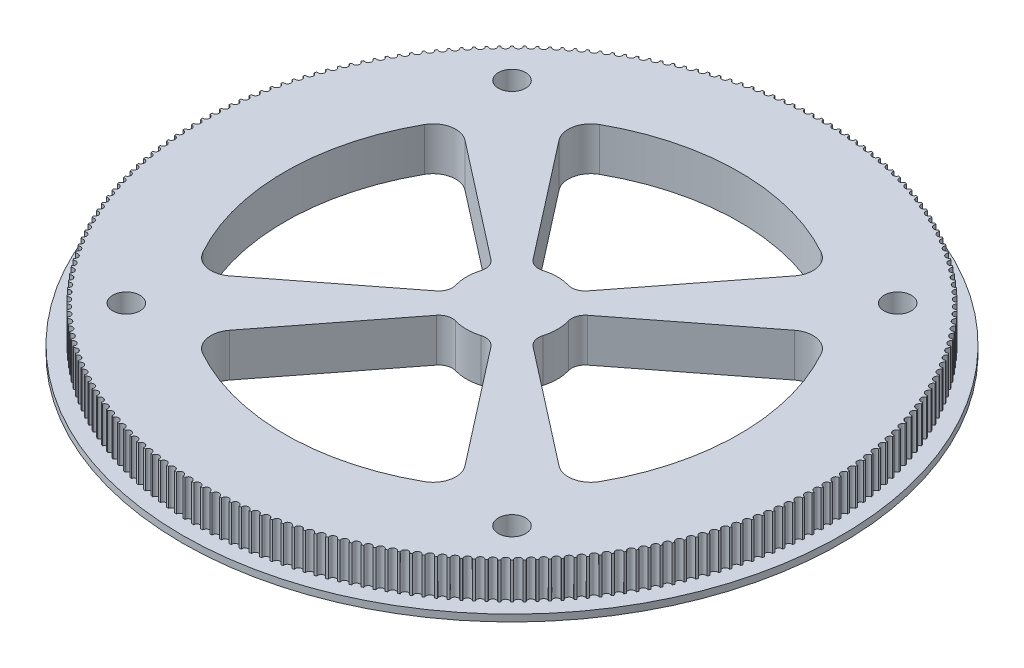
from build123d import *

# Parameters (mm, degrees)
BOSS_EXTRUDE1_DEPTH = 8
SKETCH3_R           = 72.5
BOSS_EXTRUDE3_DEPTH = 1.5
SKETCH6_R           = 3
CUT_EXTRUDE3_DEPTH  = 103.969655724
CUT_EXTRUDE4_DEPTH  = 103.969655724
FILLET1_R           = 3
FILLET2_R           = 5


with BuildPart() as part:
    # Sketch1 → Boss-Extrude1 (new body)
    with BuildSketch(Plane(origin=(0, 0, 0), x_dir=(1, 0, 0), z_dir=(0, 1, 0))):
        with BuildLine():
            ThreePointArc((-0.759988559, 69.250829904), (-0.988925477, 69.247938969), (-1.217851586, 69.244291191))
            ThreePointArc((-1.217851586, 69.244291191), (-1.955946699, 68.467067248), (-2.737208847, 69.200886647))
            ThreePointArc((-2.737208847, 69.200886647), (-2.965969848, 69.191459356), (-3.194698434, 69.18127584))
            ThreePointArc((-3.194698434, 69.18127584), (-3.9102981, 68.383291773), (-4.712196627, 69.094502154))
            ThreePointArc((-4.712196627, 69.094502154), (-4.940595132, 69.078546197), (-5.168939639, 69.061835249))
            ThreePointArc((-5.168939639, 69.061835249), (-5.861460206, 68.243741905), (-6.683341073, 68.931763195))
            ThreePointArc((-6.683341073, 68.931763195), (-6.911190796, 68.909291585), (-7.138964984, 68.886066835))
            ThreePointArc((-7.138964984, 68.886066835), (-7.80784162, 68.048531463), (-8.64903449, 68.7128025))
            ThreePointArc((-8.64903449, 68.7128025), (-8.876149594, 68.683833566), (-9.103167686, 68.654113956))
            ThreePointArc((-9.103167686, 68.654113956), (-9.747854848, 67.797819662), (-10.60767363, 68.437798658))
            ThreePointArc((-10.60767363, 68.437798658), (-10.833868876, 68.402356028), (-11.059945715, 68.366165797))
            ThreePointArc((-11.059945715, 68.366165797), (-11.679917584, 67.491810986), (-12.557660999, 68.106975966))
            ThreePointArc((-12.557660999, 68.106975966), (-12.7827519, 68.065088547), (-13.007703093, 68.022457213))
            ThreePointArc((-13.007703093, 68.022457213), (-13.602454013, 67.130755022), (-14.49740616, 67.720604247))
            ThreePointArc((-14.49740616, 67.720604247), (-14.721209128, 67.672306203), (-14.944851201, 67.623268537))
            ThreePointArc((-14.944851201, 67.623268537), (-15.513896085, 66.714946251), (-16.425327028, 67.278998633))
            ThreePointArc((-16.425327028, 67.278998633), (-16.647659527, 67.224329355), (-16.869810075, 67.168925353))
            ThreePointArc((-16.869810075, 67.168925353), (-17.412684801, 66.244723813), (-18.339851164, 66.782519302))
            ThreePointArc((-18.339851164, 66.782519302), (-18.560531855, 66.721523381), (-18.78100969, 66.65979823))
            ThreePointArc((-18.78100969, 66.65979823), (-19.297271481, 65.720471228), (-20.239417055, 66.23157119))
            ThreePointArc((-20.239417055, 66.23157119), (-20.458265948, 66.164298375), (-20.676891243, 66.096302419))
            ThreePointArc((-20.676891243, 66.096302419), (-21.16611903, 65.142616084), (-22.122475387, 65.626603659))
            ThreePointArc((-22.122475387, 65.626603659), (-22.339313986, 65.553108818), (-22.555908428, 65.478897517))
            ThreePointArc((-22.555908428, 65.478897517), (-23.017703188, 64.511629687), (-23.98749031, 64.968110128))
            ThreePointArc((-23.98749031, 64.968110128), (-24.202141758, 64.888453205), (-24.41652869, 64.808087086))
            ThreePointArc((-24.41652869, 64.808087086), (-24.850513778, 63.828026681), (-25.832940692, 64.256627675))
            ThreePointArc((-25.832940692, 64.256627675), (-26.045229917, 64.170873639), (-26.257234481, 64.08441825))
            ThreePointArc((-26.257234481, 64.08441825), (-26.663055932, 63.09236462), (-27.657321357, 63.492736595))
            ThreePointArc((-27.657321357, 63.492736595), (-27.867075212, 63.400955388), (-28.076524495, 63.308481243))
            ThreePointArc((-28.076524495, 63.308481243), (-28.453851316, 62.305243522), (-29.459144315, 62.677059928))
            ThreePointArc((-29.459144315, 62.677059928), (-29.666191722, 62.579326408), (-29.872914893, 62.48090893))
            ThreePointArc((-29.872914893, 62.48090893), (-30.22143933, 61.467305373), (-31.236939971, 61.810262952))
            ThreePointArc((-31.236939971, 61.810262952), (-31.441112059, 61.706656833), (-31.644940513, 61.602376293))
            ThreePointArc((-31.644940513, 61.602376293), (-31.964378304, 60.579233609), (-32.989258331, 60.893052639))
            ThreePointArc((-32.989258331, 60.893052639), (-33.190388575, 60.783658422), (-33.391156066, 60.673599873))
            ThreePointArc((-33.391156066, 60.673599873), (-33.681246674, 59.641752552), (-34.71467018, 59.926177079))
            ThreePointArc((-34.71467018, 59.926177079), (-34.912594534, 59.811083989), (-35.110137313, 59.695337195))
            ThreePointArc((-35.110137313, 59.695337195), (-35.370644135, 58.655626827), (-36.411768245, 58.910424869))
            ThreePointArc((-36.411768245, 58.910424869), (-36.60632528, 58.789726777), (-36.800482228, 58.668386144))
            ThreePointArc((-36.800482228, 58.668386144), (-37.031192792, 57.621660731), (-38.079168349, 57.846624472))
            ThreePointArc((-38.079168349, 57.846624472), (-38.270199382, 57.72041982), (-38.460812142, 57.593584316))
            ThreePointArc((-38.460812142, 57.593584316), (-38.661538276, 56.540697582), (-39.715510538, 56.735643538))
            ThreePointArc((-39.715510538, 56.735643538), (-39.902859761, 56.604035262), (-40.089772867, 56.471808334))
            ThreePointArc((-40.089772867, 56.471808334), (-40.260350856, 55.41361903), (-41.319460187, 55.5783882))
            ThreePointArc((-41.319460187, 55.5783882), (-41.502974794, 55.44148364), (-41.686035797, 55.303973135))
            ThreePointArc((-41.686035797, 55.303973135), (-41.826326516, 54.241344334), (-42.889709091, 54.375802331))
            ThreePointArc((-42.889709091, 54.375802331), (-43.069239406, 54.233713149), (-43.248298998, 54.091031223))
            ThreePointArc((-43.248298998, 54.091031223), (-43.358188024, 53.024829621), (-44.424976533, 53.128866777))
            ThreePointArc((-44.424976533, 53.128866777), (-44.600376129, 52.981708864), (-44.775288267, 52.833971889))
            ThreePointArc((-44.775288267, 52.833971889), (-44.854685972, 51.765067095), (-45.924010327, 51.838598558))
            ThreePointArc((-45.924010327, 51.838598558), (-46.095136145, 51.686491937), (-46.265758168, 51.533820411))
            ThreePointArc((-46.265758168, 51.533820411), (-46.314599794, 50.463084239), (-47.38558784, 50.506050034))
            ThreePointArc((-47.38558784, 50.506050034), (-47.552300307, 50.349118766), (-47.718493053, 50.191637209))
            ThreePointArc((-47.718493053, 50.191637209), (-47.736738765, 49.119942967), (-48.808516988, 49.132308051))
            ThreePointArc((-48.808516988, 49.132308051), (-48.970680131, 48.970680131), (-49.132308051, 48.808516988))
            ThreePointArc((-49.132308051, 48.808516988), (-49.119942967, 47.736738765), (-50.191637209, 47.718493053))
            ThreePointArc((-50.191637209, 47.718493053), (-50.349118766, 47.552300307), (-50.506050034, 47.38558784))
            ThreePointArc((-50.506050034, 47.38558784), (-50.463084239, 46.314599794), (-51.533820411, 46.265758168))
            ThreePointArc((-51.533820411, 46.265758168), (-51.686491937, 46.095136145), (-51.838598558, 45.924010327))
            ThreePointArc((-51.838598558, 45.924010327), (-51.765067095, 44.854685972), (-52.833971889, 44.775288267))
            ThreePointArc((-52.833971889, 44.775288267), (-52.981708864, 44.600376129), (-53.128866777, 44.424976533))
            ThreePointArc((-53.128866777, 44.424976533), (-53.024829621, 43.358188024), (-54.091031223, 43.248298998))
            ThreePointArc((-54.091031223, 43.248298998), (-54.233713149, 43.069239406), (-54.375802331, 42.889709091))
            ThreePointArc((-54.375802331, 42.889709091), (-54.241344334, 41.826326516), (-55.303973135, 41.686035797))
            ThreePointArc((-55.303973135, 41.686035797), (-55.44148364, 41.502974794), (-55.5783882, 41.319460187))
            ThreePointArc((-55.5783882, 41.319460187), (-55.41361903, 40.260350856), (-56.471808334, 40.089772867))
            ThreePointArc((-56.471808334, 40.089772867), (-56.604035262, 39.902859761), (-56.735643538, 39.715510538))
            ThreePointArc((-56.735643538, 39.715510538), (-56.540697582, 38.661538276), (-57.593584316, 38.460812142))
            ThreePointArc((-57.593584316, 38.460812142), (-57.72041982, 38.270199382), (-57.846624472, 38.079168349))
            ThreePointArc((-57.846624472, 38.079168349), (-57.621660731, 37.031192792), (-58.668386144, 36.800482228))
            ThreePointArc((-58.668386144, 36.800482228), (-58.789726777, 36.60632528), (-58.910424869, 36.411768245))
            ThreePointArc((-58.910424869, 36.411768245), (-58.655626827, 35.370644135), (-59.695337195, 35.110137313))
            ThreePointArc((-59.695337195, 35.110137313), (-59.811083989, 34.912594534), (-59.926177079, 34.71467018))
            ThreePointArc((-59.926177079, 34.71467018), (-59.641752552, 33.681246674), (-60.673599873, 33.391156066))
            ThreePointArc((-60.673599873, 33.391156066), (-60.783658422, 33.190388575), (-60.893052639, 32.989258331))
            ThreePointArc((-60.893052639, 32.989258331), (-60.579233609, 31.964378304), (-61.602376293, 31.644940513))
            ThreePointArc((-61.602376293, 31.644940513), (-61.706656833, 31.441112059), (-61.810262952, 31.236939971))
            ThreePointArc((-61.810262952, 31.236939971), (-61.467305373, 30.22143933), (-62.48090893, 29.872914893))
            ThreePointArc((-62.48090893, 29.872914893), (-62.579326408, 29.666191722), (-62.677059928, 29.459144315))
            ThreePointArc((-62.677059928, 29.459144315), (-62.305243522, 28.453851316), (-63.308481243, 28.076524495))
            ThreePointArc((-63.308481243, 28.076524495), (-63.400955388, 27.867075212), (-63.492736595, 27.657321357))
            ThreePointArc((-63.492736595, 27.657321357), (-63.09236462, 26.663055932), (-64.08441825, 26.257234481))
            ThreePointArc((-64.08441825, 26.257234481), (-64.170873639, 26.045229917), (-64.256627675, 25.832940692))
            ThreePointArc((-64.256627675, 25.832940692), (-63.828026681, 24.850513778), (-64.808087086, 24.41652869))
            ThreePointArc((-64.808087086, 24.41652869), (-64.888453205, 24.202141758), (-64.968110128, 23.98749031))
            ThreePointArc((-64.968110128, 23.98749031), (-64.511629687, 23.017703188), (-65.478897517, 22.555908428))
            ThreePointArc((-65.478897517, 22.555908428), (-65.553108818, 22.339313986), (-65.626603659, 22.122475387))
            ThreePointArc((-65.626603659, 22.122475387), (-65.142616084, 21.16611903), (-66.096302419, 20.676891243))
            ThreePointArc((-66.096302419, 20.676891243), (-66.164298375, 20.458265948), (-66.23157119, 20.239417055))
            ThreePointArc((-66.23157119, 20.239417055), (-65.720471228, 19.297271481), (-66.65979823, 18.78100969))
            ThreePointArc((-66.65979823, 18.78100969), (-66.721523381, 18.560531855), (-66.782519302, 18.339851164))
            ThreePointArc((-66.782519302, 18.339851164), (-66.244723813, 17.412684801), (-67.168925353, 16.869810075))
            ThreePointArc((-67.168925353, 16.869810075), (-67.224329355, 16.647659527), (-67.278998633, 16.425327028))
            ThreePointArc((-67.278998633, 16.425327028), (-66.714946251, 15.513896085), (-67.623268537, 14.944851201))
            ThreePointArc((-67.623268537, 14.944851201), (-67.672306203, 14.721209128), (-67.720604247, 14.49740616))
            ThreePointArc((-67.720604247, 14.49740616), (-67.130755022, 13.602454013), (-68.022457213, 13.007703093))
            ThreePointArc((-68.022457213, 13.007703093), (-68.065088547, 12.7827519), (-68.106975966, 12.557660999))
            ThreePointArc((-68.106975966, 12.557660999), (-67.491810986, 11.679917584), (-68.366165797, 11.059945715))
            ThreePointArc((-68.366165797, 11.059945715), (-68.402356028, 10.833868876), (-68.437798658, 10.60767363))
            ThreePointArc((-68.437798658, 10.60767363), (-67.797819662, 9.747854848), (-68.654113956, 9.103167686))
            ThreePointArc((-68.654113956, 9.103167686), (-68.683833566, 8.876149594), (-68.7128025, 8.64903449))
            ThreePointArc((-68.7128025, 8.64903449), (-68.048531463, 7.80784162), (-68.886066835, 7.138964984))
            ThreePointArc((-68.886066835, 7.138964984), (-68.909291585, 6.911190796), (-68.931763195, 6.683341073))
            ThreePointArc((-68.931763195, 6.683341073), (-68.243741905, 5.861460206), (-69.061835249, 5.168939639))
            ThreePointArc((-69.061835249, 5.168939639), (-69.078546197, 4.940595132), (-69.094502154, 4.712196627))
            ThreePointArc((-69.094502154, 4.712196627), (-68.383291773, 3.9102981), (-69.18127584, 3.194698434))
            ThreePointArc((-69.18127584, 3.194698434), (-69.191459356, 2.965969848), (-69.200886647, 2.737208847))
            ThreePointArc((-69.200886647, 2.737208847), (-68.467067248, 1.955946699), (-69.244291191, 1.217851586))
            ThreePointArc((-69.244291191, 1.217851586), (-69.247938969, 0.988925477), (-69.250829904, 0.759988559))
            ThreePointArc((-69.250829904, 0.759988559), (-68.495, 0), (-69.250829904, -0.759988559))
            ThreePointArc((-69.250829904, -0.759988559), (-69.247938969, -0.988925477), (-69.244291191, -1.217851586))
            ThreePointArc((-69.244291191, -1.217851586), (-68.467067248, -1.955946699), (-69.200886647, -2.737208847))
            ThreePointArc((-69.200886647, -2.737208847), (-69.191459356, -2.965969848), (-69.18127584, -3.194698434))
            ThreePointArc((-69.18127584, -3.194698434), (-68.383291773, -3.9102981), (-69.094502154, -4.712196627))
            ThreePointArc((-69.094502154, -4.712196627), (-69.078546197, -4.940595132), (-69.061835249, -5.168939639))
            ThreePointArc((-69.061835249, -5.168939639), (-68.243741905, -5.861460206), (-68.931763195, -6.683341073))
            ThreePointArc((-68.931763195, -6.683341073), (-68.909291585, -6.911190796), (-68.886066835, -7.138964984))
            ThreePointArc((-68.886066835, -7.138964984), (-68.048531463, -7.80784162), (-68.7128025, -8.64903449))
            ThreePointArc((-68.7128025, -8.64903449), (-68.683833566, -8.876149594), (-68.654113956, -9.103167686))
            ThreePointArc((-68.654113956, -9.103167686), (-67.797819662, -9.747854848), (-68.437798658, -10.60767363))
            ThreePointArc((-68.437798658, -10.60767363), (-68.402356028, -10.833868876), (-68.366165797, -11.059945715))
            ThreePointArc((-68.366165797, -11.059945715), (-67.491810986, -11.679917584), (-68.106975966, -12.557660999))
            ThreePointArc((-68.106975966, -12.557660999), (-68.065088547, -12.7827519), (-68.022457213, -13.007703093))
            ThreePointArc((-68.022457213, -13.007703093), (-67.130755022, -13.602454013), (-67.720604247, -14.49740616))
            ThreePointArc((-67.720604247, -14.49740616), (-67.672306203, -14.721209128), (-67.623268537, -14.944851201))
            ThreePointArc((-67.623268537, -14.944851201), (-66.714946251, -15.513896085), (-67.278998633, -16.425327028))
            ThreePointArc((-67.278998633, -16.425327028), (-67.224329355, -16.647659527), (-67.168925353, -16.869810075))
            ThreePointArc((-67.168925353, -16.869810075), (-66.244723813, -17.412684801), (-66.782519302, -18.339851164))
            ThreePointArc((-66.782519302, -18.339851164), (-66.721523381, -18.560531855), (-66.65979823, -18.78100969))
            ThreePointArc((-66.65979823, -18.78100969), (-65.720471228, -19.297271481), (-66.23157119, -20.239417055))
            ThreePointArc((-66.23157119, -20.239417055), (-66.164298375, -20.458265948), (-66.096302419, -20.676891243))
            ThreePointArc((-66.096302419, -20.676891243), (-65.142616084, -21.16611903), (-65.626603659, -22.122475387))
            ThreePointArc((-65.626603659, -22.122475387), (-65.553108818, -22.339313986), (-65.478897517, -22.555908428))
            ThreePointArc((-65.478897517, -22.555908428), (-64.511629687, -23.017703188), (-64.968110128, -23.98749031))
            ThreePointArc((-64.968110128, -23.98749031), (-64.888453205, -24.202141758), (-64.808087086, -24.41652869))
            ThreePointArc((-64.808087086, -24.41652869), (-63.828026681, -24.850513778), (-64.256627675, -25.832940692))
            ThreePointArc((-64.256627675, -25.832940692), (-64.170873639, -26.045229917), (-64.08441825, -26.257234481))
            ThreePointArc((-64.08441825, -26.257234481), (-63.09236462, -26.663055932), (-63.492736595, -27.657321357))
            ThreePointArc((-63.492736595, -27.657321357), (-63.400955388, -27.867075212), (-63.308481243, -28.076524495))
            ThreePointArc((-63.308481243, -28.076524495), (-62.305243522, -28.453851316), (-62.677059928, -29.459144315))
            ThreePointArc((-62.677059928, -29.459144315), (-62.579326408, -29.666191722), (-62.48090893, -29.872914893))
            ThreePointArc((-62.48090893, -29.872914893), (-61.467305373, -30.22143933), (-61.810262952, -31.236939971))
            ThreePointArc((-61.810262952, -31.236939971), (-61.706656833, -31.441112059), (-61.602376293, -31.644940513))
            ThreePointArc((-61.602376293, -31.644940513), (-60.579233609, -31.964378304), (-60.893052639, -32.989258331))
            ThreePointArc((-60.893052639, -32.989258331), (-60.783658422, -33.190388575), (-60.673599873, -33.391156066))
            ThreePointArc((-60.673599873, -33.391156066), (-59.641752552, -33.681246674), (-59.926177079, -34.71467018))
            ThreePointArc((-59.926177079, -34.71467018), (-59.811083989, -34.912594534), (-59.695337195, -35.110137313))
            ThreePointArc((-59.695337195, -35.110137313), (-58.655626827, -35.370644135), (-58.910424869, -36.411768245))
            ThreePointArc((-58.910424869, -36.411768245), (-58.789726777, -36.60632528), (-58.668386144, -36.800482228))
            ThreePointArc((-58.668386144, -36.800482228), (-57.621660731, -37.031192792), (-57.846624472, -38.079168349))
            ThreePointArc((-57.846624472, -38.079168349), (-57.72041982, -38.270199382), (-57.593584316, -38.460812142))
            ThreePointArc((-57.593584316, -38.460812142), (-56.540697582, -38.661538276), (-56.735643538, -39.715510538))
            ThreePointArc((-56.735643538, -39.715510538), (-56.604035262, -39.902859761), (-56.471808334, -40.089772867))
            ThreePointArc((-56.471808334, -40.089772867), (-55.41361903, -40.260350856), (-55.5783882, -41.319460187))
            ThreePointArc((-55.5783882, -41.319460187), (-55.44148364, -41.502974794), (-55.303973135, -41.686035797))
            ThreePointArc((-55.303973135, -41.686035797), (-54.241344334, -41.826326516), (-54.375802331, -42.889709091))
            ThreePointArc((-54.375802331, -42.889709091), (-54.233713149, -43.069239406), (-54.091031223, -43.248298998))
            ThreePointArc((-54.091031223, -43.248298998), (-53.024829621, -43.358188024), (-53.128866777, -44.424976533))
            ThreePointArc((-53.128866777, -44.424976533), (-52.981708864, -44.600376129), (-52.833971889, -44.775288267))
            ThreePointArc((-52.833971889, -44.775288267), (-51.765067095, -44.854685972), (-51.838598558, -45.924010327))
            ThreePointArc((-51.838598558, -45.924010327), (-51.686491937, -46.095136145), (-51.533820411, -46.265758168))
            ThreePointArc((-51.533820411, -46.265758168), (-50.463084239, -46.314599794), (-50.506050034, -47.38558784))
            ThreePointArc((-50.506050034, -47.38558784), (-50.349118766, -47.552300307), (-50.191637209, -47.718493053))
            ThreePointArc((-50.191637209, -47.718493053), (-49.119942967, -47.736738765), (-49.132308051, -48.808516988))
            ThreePointArc((-49.132308051, -48.808516988), (-48.970680131, -48.970680131), (-48.808516988, -49.132308051))
            ThreePointArc((-48.808516988, -49.132308051), (-47.736738765, -49.119942967), (-47.718493053, -50.191637209))
            ThreePointArc((-47.718493053, -50.191637209), (-47.552300307, -50.349118766), (-47.38558784, -50.506050034))
            ThreePointArc((-47.38558784, -50.506050034), (-46.314599794, -50.463084239), (-46.265758168, -51.533820411))
            ThreePointArc((-46.265758168, -51.533820411), (-46.095136145, -51.686491937), (-45.924010327, -51.838598558))
            ThreePointArc((-45.924010327, -51.838598558), (-44.854685972, -51.765067095), (-44.775288267, -52.833971889))
            ThreePointArc((-44.775288267, -52.833971889), (-44.600376129, -52.981708864), (-44.424976533, -53.128866777))
            ThreePointArc((-44.424976533, -53.128866777), (-43.358188024, -53.024829621), (-43.248298998, -54.091031223))
            ThreePointArc((-43.248298998, -54.091031223), (-43.069239406, -54.233713149), (-42.889709091, -54.375802331))
            ThreePointArc((-42.889709091, -54.375802331), (-41.826326516, -54.241344334), (-41.686035797, -55.303973135))
            ThreePointArc((-41.686035797, -55.303973135), (-41.502974794, -55.44148364), (-41.319460187, -55.5783882))
            ThreePointArc((-41.319460187, -55.5783882), (-40.260350856, -55.41361903), (-40.089772867, -56.471808334))
            ThreePointArc((-40.089772867, -56.471808334), (-39.902859761, -56.604035262), (-39.715510538, -56.735643538))
            ThreePointArc((-39.715510538, -56.735643538), (-38.661538276, -56.540697582), (-38.460812142, -57.593584316))
            ThreePointArc((-38.460812142, -57.593584316), (-38.270199382, -57.72041982), (-38.079168349, -57.846624472))
            ThreePointArc((-38.079168349, -57.846624472), (-37.031192792, -57.621660731), (-36.800482228, -58.668386144))
            ThreePointArc((-36.800482228, -58.668386144), (-36.60632528, -58.789726777), (-36.411768245, -58.910424869))
            ThreePointArc((-36.411768245, -58.910424869), (-35.370644135, -58.655626827), (-35.110137313, -59.695337195))
            ThreePointArc((-35.110137313, -59.695337195), (-34.912594534, -59.811083989), (-34.71467018, -59.926177079))
            ThreePointArc((-34.71467018, -59.926177079), (-33.681246674, -59.641752552), (-33.391156066, -60.673599873))
            ThreePointArc((-33.391156066, -60.673599873), (-33.190388575, -60.783658422), (-32.989258331, -60.893052639))
            ThreePointArc((-32.989258331, -60.893052639), (-31.964378304, -60.579233609), (-31.644940513, -61.602376293))
            ThreePointArc((-31.644940513, -61.602376293), (-31.441112059, -61.706656833), (-31.236939971, -61.810262952))
            ThreePointArc((-31.236939971, -61.810262952), (-30.22143933, -61.467305373), (-29.872914893, -62.48090893))
            ThreePointArc((-29.872914893, -62.48090893), (-29.666191722, -62.579326408), (-29.459144315, -62.677059928))
            ThreePointArc((-29.459144315, -62.677059928), (-28.453851316, -62.305243522), (-28.076524495, -63.308481243))
            ThreePointArc((-28.076524495, -63.308481243), (-27.867075212, -63.400955388), (-27.657321357, -63.492736595))
            ThreePointArc((-27.657321357, -63.492736595), (-26.663055932, -63.09236462), (-26.257234481, -64.08441825))
            ThreePointArc((-26.257234481, -64.08441825), (-26.045229917, -64.170873639), (-25.832940692, -64.256627675))
            ThreePointArc((-25.832940692, -64.256627675), (-24.850513778, -63.828026681), (-24.41652869, -64.808087086))
            ThreePointArc((-24.41652869, -64.808087086), (-24.202141758, -64.888453205), (-23.98749031, -64.968110128))
            ThreePointArc((-23.98749031, -64.968110128), (-23.017703188, -64.511629687), (-22.555908428, -65.478897517))
            ThreePointArc((-22.555908428, -65.478897517), (-22.339313986, -65.553108818), (-22.122475387, -65.626603659))
            ThreePointArc((-22.122475387, -65.626603659), (-21.16611903, -65.142616084), (-20.676891243, -66.096302419))
            ThreePointArc((-20.676891243, -66.096302419), (-20.458265948, -66.164298375), (-20.239417055, -66.23157119))
            ThreePointArc((-20.239417055, -66.23157119), (-19.297271481, -65.720471228), (-18.78100969, -66.65979823))
            ThreePointArc((-18.78100969, -66.65979823), (-18.560531855, -66.721523381), (-18.339851164, -66.782519302))
            ThreePointArc((-18.339851164, -66.782519302), (-17.412684801, -66.244723813), (-16.869810075, -67.168925353))
            ThreePointArc((-16.869810075, -67.168925353), (-16.647659527, -67.224329355), (-16.425327028, -67.278998633))
            ThreePointArc((-16.425327028, -67.278998633), (-15.513896085, -66.714946251), (-14.944851201, -67.623268537))
            ThreePointArc((-14.944851201, -67.623268537), (-14.721209128, -67.672306203), (-14.49740616, -67.720604247))
            ThreePointArc((-14.49740616, -67.720604247), (-13.602454013, -67.130755022), (-13.007703093, -68.022457213))
            ThreePointArc((-13.007703093, -68.022457213), (-12.7827519, -68.065088547), (-12.557660999, -68.106975966))
            ThreePointArc((-12.557660999, -68.106975966), (-11.679917584, -67.491810986), (-11.059945715, -68.366165797))
            ThreePointArc((-11.059945715, -68.366165797), (-10.833868876, -68.402356028), (-10.60767363, -68.437798658))
            ThreePointArc((-10.60767363, -68.437798658), (-9.747854848, -67.797819662), (-9.103167686, -68.654113956))
            ThreePointArc((-9.103167686, -68.654113956), (-8.876149594, -68.683833566), (-8.64903449, -68.7128025))
            ThreePointArc((-8.64903449, -68.7128025), (-7.80784162, -68.048531463), (-7.138964984, -68.886066835))
            ThreePointArc((-7.138964984, -68.886066835), (-6.911190796, -68.909291585), (-6.683341073, -68.931763195))
            ThreePointArc((-6.683341073, -68.931763195), (-5.861460206, -68.243741905), (-5.168939639, -69.061835249))
            ThreePointArc((-5.168939639, -69.061835249), (-4.940595132, -69.078546197), (-4.712196627, -69.094502154))
            ThreePointArc((-4.712196627, -69.094502154), (-3.9102981, -68.383291773), (-3.194698434, -69.18127584))
            ThreePointArc((-3.194698434, -69.18127584), (-2.965969848, -69.191459356), (-2.737208847, -69.200886647))
            ThreePointArc((-2.737208847, -69.200886647), (-1.955946699, -68.467067248), (-1.217851586, -69.244291191))
            ThreePointArc((-1.217851586, -69.244291191), (-0.988925477, -69.247938969), (-0.759988559, -69.250829904))
            ThreePointArc((-0.759988559, -69.250829904), (0, -68.495), (0.759988559, -69.250829904))
            ThreePointArc((0.759988559, -69.250829904), (0.988925477, -69.247938969), (1.217851586, -69.244291191))
            ThreePointArc((1.217851586, -69.244291191), (1.955946699, -68.467067248), (2.737208847, -69.200886647))
            ThreePointArc((2.737208847, -69.200886647), (2.965969848, -69.191459356), (3.194698434, -69.18127584))
            ThreePointArc((3.194698434, -69.18127584), (3.9102981, -68.383291773), (4.712196627, -69.094502154))
            ThreePointArc((4.712196627, -69.094502154), (4.940595132, -69.078546197), (5.168939639, -69.061835249))
            ThreePointArc((5.168939639, -69.061835249), (5.861460206, -68.243741905), (6.683341073, -68.931763195))
            ThreePointArc((6.683341073, -68.931763195), (6.911190796, -68.909291585), (7.138964984, -68.886066835))
            ThreePointArc((7.138964984, -68.886066835), (7.80784162, -68.048531463), (8.64903449, -68.7128025))
            ThreePointArc((8.64903449, -68.7128025), (8.876149594, -68.683833566), (9.103167686, -68.654113956))
            ThreePointArc((9.103167686, -68.654113956), (9.747854848, -67.797819662), (10.60767363, -68.437798658))
            ThreePointArc((10.60767363, -68.437798658), (10.833868876, -68.402356028), (11.059945715, -68.366165797))
            ThreePointArc((11.059945715, -68.366165797), (11.679917584, -67.491810986), (12.557660999, -68.106975966))
            ThreePointArc((12.557660999, -68.106975966), (12.7827519, -68.065088547), (13.007703093, -68.022457213))
            ThreePointArc((13.007703093, -68.022457213), (13.602454013, -67.130755022), (14.49740616, -67.720604247))
            ThreePointArc((14.49740616, -67.720604247), (14.721209128, -67.672306203), (14.944851201, -67.623268537))
            ThreePointArc((14.944851201, -67.623268537), (15.513896085, -66.714946251), (16.425327028, -67.278998633))
            ThreePointArc((16.425327028, -67.278998633), (16.647659527, -67.224329355), (16.869810075, -67.168925353))
            ThreePointArc((16.869810075, -67.168925353), (17.412684801, -66.244723813), (18.339851164, -66.782519302))
            ThreePointArc((18.339851164, -66.782519302), (18.560531855, -66.721523381), (18.78100969, -66.65979823))
            ThreePointArc((18.78100969, -66.65979823), (19.297271481, -65.720471228), (20.239417055, -66.23157119))
            ThreePointArc((20.239417055, -66.23157119), (20.458265948, -66.164298375), (20.676891243, -66.096302419))
            ThreePointArc((20.676891243, -66.096302419), (21.16611903, -65.142616084), (22.122475387, -65.626603659))
            ThreePointArc((22.122475387, -65.626603659), (22.339313986, -65.553108818), (22.555908428, -65.478897517))
            ThreePointArc((22.555908428, -65.478897517), (23.017703188, -64.511629687), (23.98749031, -64.968110128))
            ThreePointArc((23.98749031, -64.968110128), (24.202141758, -64.888453205), (24.41652869, -64.808087086))
            ThreePointArc((24.41652869, -64.808087086), (24.850513778, -63.828026681), (25.832940692, -64.256627675))
            ThreePointArc((25.832940692, -64.256627675), (26.045229917, -64.170873639), (26.257234481, -64.08441825))
            ThreePointArc((26.257234481, -64.08441825), (26.663055932, -63.09236462), (27.657321357, -63.492736595))
            ThreePointArc((27.657321357, -63.492736595), (27.867075212, -63.400955388), (28.076524495, -63.308481243))
            ThreePointArc((28.076524495, -63.308481243), (28.453851316, -62.305243522), (29.459144315, -62.677059928))
            ThreePointArc((29.459144315, -62.677059928), (29.666191722, -62.579326408), (29.872914893, -62.48090893))
            ThreePointArc((29.872914893, -62.48090893), (30.22143933, -61.467305373), (31.236939971, -61.810262952))
            ThreePointArc((31.236939971, -61.810262952), (31.441112059, -61.706656833), (31.644940513, -61.602376293))
            ThreePointArc((31.644940513, -61.602376293), (31.964378304, -60.579233609), (32.989258331, -60.893052639))
            ThreePointArc((32.989258331, -60.893052639), (33.190388575, -60.783658422), (33.391156066, -60.673599873))
            ThreePointArc((33.391156066, -60.673599873), (33.681246674, -59.641752552), (34.71467018, -59.926177079))
            ThreePointArc((34.71467018, -59.926177079), (34.912594534, -59.811083989), (35.110137313, -59.695337195))
            ThreePointArc((35.110137313, -59.695337195), (35.370644135, -58.655626827), (36.411768245, -58.910424869))
            ThreePointArc((36.411768245, -58.910424869), (36.60632528, -58.789726777), (36.800482228, -58.668386144))
            ThreePointArc((36.800482228, -58.668386144), (37.031192792, -57.621660731), (38.079168349, -57.846624472))
            ThreePointArc((38.079168349, -57.846624472), (38.270199382, -57.72041982), (38.460812142, -57.593584316))
            ThreePointArc((38.460812142, -57.593584316), (38.661538276, -56.540697582), (39.715510538, -56.735643538))
            ThreePointArc((39.715510538, -56.735643538), (39.902859761, -56.604035262), (40.089772867, -56.471808334))
            ThreePointArc((40.089772867, -56.471808334), (40.260350856, -55.41361903), (41.319460187, -55.5783882))
            ThreePointArc((41.319460187, -55.5783882), (41.502974794, -55.44148364), (41.686035797, -55.303973135))
            ThreePointArc((41.686035797, -55.303973135), (41.826326516, -54.241344334), (42.889709091, -54.375802331))
            ThreePointArc((42.889709091, -54.375802331), (43.069239406, -54.233713149), (43.248298998, -54.091031223))
            ThreePointArc((43.248298998, -54.091031223), (43.358188024, -53.024829621), (44.424976533, -53.128866777))
            ThreePointArc((44.424976533, -53.128866777), (44.600376129, -52.981708864), (44.775288267, -52.833971889))
            ThreePointArc((44.775288267, -52.833971889), (44.854685972, -51.765067095), (45.924010327, -51.838598558))
            ThreePointArc((45.924010327, -51.838598558), (46.095136145, -51.686491937), (46.265758168, -51.533820411))
            ThreePointArc((46.265758168, -51.533820411), (46.314599794, -50.463084239), (47.38558784, -50.506050034))
            ThreePointArc((47.38558784, -50.506050034), (47.552300307, -50.349118766), (47.718493053, -50.191637209))
            ThreePointArc((47.718493053, -50.191637209), (47.736738765, -49.119942967), (48.808516988, -49.132308051))
            ThreePointArc((48.808516988, -49.132308051), (48.970680131, -48.970680131), (49.132308051, -48.808516988))
            ThreePointArc((49.132308051, -48.808516988), (49.119942967, -47.736738765), (50.191637209, -47.718493053))
            ThreePointArc((50.191637209, -47.718493053), (50.349118766, -47.552300307), (50.506050034, -47.38558784))
            ThreePointArc((50.506050034, -47.38558784), (50.463084239, -46.314599794), (51.533820411, -46.265758168))
            ThreePointArc((51.533820411, -46.265758168), (51.686491937, -46.095136145), (51.838598558, -45.924010327))
            ThreePointArc((51.838598558, -45.924010327), (51.765067095, -44.854685972), (52.833971889, -44.775288267))
            ThreePointArc((52.833971889, -44.775288267), (52.981708864, -44.600376129), (53.128866777, -44.424976533))
            ThreePointArc((53.128866777, -44.424976533), (53.024829621, -43.358188024), (54.091031223, -43.248298998))
            ThreePointArc((54.091031223, -43.248298998), (54.233713149, -43.069239406), (54.375802331, -42.889709091))
            ThreePointArc((54.375802331, -42.889709091), (54.241344334, -41.826326516), (55.303973135, -41.686035797))
            ThreePointArc((55.303973135, -41.686035797), (55.44148364, -41.502974794), (55.5783882, -41.319460187))
            ThreePointArc((55.5783882, -41.319460187), (55.41361903, -40.260350856), (56.471808334, -40.089772867))
            ThreePointArc((56.471808334, -40.089772867), (56.604035262, -39.902859761), (56.735643538, -39.715510538))
            ThreePointArc((56.735643538, -39.715510538), (56.540697582, -38.661538276), (57.593584316, -38.460812142))
            ThreePointArc((57.593584316, -38.460812142), (57.72041982, -38.270199382), (57.846624472, -38.079168349))
            ThreePointArc((57.846624472, -38.079168349), (57.621660731, -37.031192792), (58.668386144, -36.800482228))
            ThreePointArc((58.668386144, -36.800482228), (58.789726777, -36.60632528), (58.910424869, -36.411768245))
            ThreePointArc((58.910424869, -36.411768245), (58.655626827, -35.370644135), (59.695337195, -35.110137313))
            ThreePointArc((59.695337195, -35.110137313), (59.811083989, -34.912594534), (59.926177079, -34.71467018))
            ThreePointArc((59.926177079, -34.71467018), (59.641752552, -33.681246674), (60.673599873, -33.391156066))
            ThreePointArc((60.673599873, -33.391156066), (60.783658422, -33.190388575), (60.893052639, -32.989258331))
            ThreePointArc((60.893052639, -32.989258331), (60.579233609, -31.964378304), (61.602376293, -31.644940513))
            ThreePointArc((61.602376293, -31.644940513), (61.706656833, -31.441112059), (61.810262952, -31.236939971))
            ThreePointArc((61.810262952, -31.236939971), (61.467305373, -30.22143933), (62.48090893, -29.872914893))
            ThreePointArc((62.48090893, -29.872914893), (62.579326408, -29.666191722), (62.677059928, -29.459144315))
            ThreePointArc((62.677059928, -29.459144315), (62.305243522, -28.453851316), (63.308481243, -28.076524495))
            ThreePointArc((63.308481243, -28.076524495), (63.400955388, -27.867075212), (63.492736595, -27.657321357))
            ThreePointArc((63.492736595, -27.657321357), (63.09236462, -26.663055932), (64.08441825, -26.257234481))
            ThreePointArc((64.08441825, -26.257234481), (64.170873639, -26.045229917), (64.256627675, -25.832940692))
            ThreePointArc((64.256627675, -25.832940692), (63.828026681, -24.850513778), (64.808087086, -24.41652869))
            ThreePointArc((64.808087086, -24.41652869), (64.888453205, -24.202141758), (64.968110128, -23.98749031))
            ThreePointArc((64.968110128, -23.98749031), (64.511629687, -23.017703188), (65.478897517, -22.555908428))
            ThreePointArc((65.478897517, -22.555908428), (65.553108818, -22.339313986), (65.626603659, -22.122475387))
            ThreePointArc((65.626603659, -22.122475387), (65.142616084, -21.16611903), (66.096302419, -20.676891243))
            ThreePointArc((66.096302419, -20.676891243), (66.164298375, -20.458265948), (66.23157119, -20.239417055))
            ThreePointArc((66.23157119, -20.239417055), (65.720471228, -19.297271481), (66.65979823, -18.78100969))
            ThreePointArc((66.65979823, -18.78100969), (66.721523381, -18.560531855), (66.782519302, -18.339851164))
            ThreePointArc((66.782519302, -18.339851164), (66.244723813, -17.412684801), (67.168925353, -16.869810075))
            ThreePointArc((67.168925353, -16.869810075), (67.224329355, -16.647659527), (67.278998633, -16.425327028))
            ThreePointArc((67.278998633, -16.425327028), (66.714946251, -15.513896085), (67.623268537, -14.944851201))
            ThreePointArc((67.623268537, -14.944851201), (67.672306203, -14.721209128), (67.720604247, -14.49740616))
            ThreePointArc((67.720604247, -14.49740616), (67.130755022, -13.602454013), (68.022457213, -13.007703093))
            ThreePointArc((68.022457213, -13.007703093), (68.065088547, -12.7827519), (68.106975966, -12.557660999))
            ThreePointArc((68.106975966, -12.557660999), (67.491810986, -11.679917584), (68.366165797, -11.059945715))
            ThreePointArc((68.366165797, -11.059945715), (68.402356028, -10.833868876), (68.437798658, -10.60767363))
            ThreePointArc((68.437798658, -10.60767363), (67.797819662, -9.747854848), (68.654113956, -9.103167686))
            ThreePointArc((68.654113956, -9.103167686), (68.683833566, -8.876149594), (68.7128025, -8.64903449))
            ThreePointArc((68.7128025, -8.64903449), (68.048531463, -7.80784162), (68.886066835, -7.138964984))
            ThreePointArc((68.886066835, -7.138964984), (68.909291585, -6.911190796), (68.931763195, -6.683341073))
            ThreePointArc((68.931763195, -6.683341073), (68.243741905, -5.861460206), (69.061835249, -5.168939639))
            ThreePointArc((69.061835249, -5.168939639), (69.078546197, -4.940595132), (69.094502154, -4.712196627))
            ThreePointArc((69.094502154, -4.712196627), (68.383291773, -3.9102981), (69.18127584, -3.194698434))
            ThreePointArc((69.18127584, -3.194698434), (69.191459356, -2.965969848), (69.200886647, -2.737208847))
            ThreePointArc((69.200886647, -2.737208847), (68.467067248, -1.955946699), (69.244291191, -1.217851586))
            ThreePointArc((69.244291191, -1.217851586), (69.247938969, -0.988925477), (69.250829904, -0.759988559))
            ThreePointArc((69.250829904, -0.759988559), (68.495, 0), (69.250829904, 0.759988559))
            ThreePointArc((69.250829904, 0.759988559), (69.247938969, 0.988925477), (69.244291191, 1.217851586))
            ThreePointArc((69.244291191, 1.217851586), (68.467067248, 1.955946699), (69.200886647, 2.737208847))
            ThreePointArc((69.200886647, 2.737208847), (69.191459356, 2.965969848), (69.18127584, 3.194698434))
            ThreePointArc((69.18127584, 3.194698434), (68.383291773, 3.9102981), (69.094502154, 4.712196627))
            ThreePointArc((69.094502154, 4.712196627), (69.078546197, 4.940595132), (69.061835249, 5.168939639))
            ThreePointArc((69.061835249, 5.168939639), (68.243741905, 5.861460206), (68.931763195, 6.683341073))
            ThreePointArc((68.931763195, 6.683341073), (68.909291585, 6.911190796), (68.886066835, 7.138964984))
            ThreePointArc((68.886066835, 7.138964984), (68.048531463, 7.80784162), (68.7128025, 8.64903449))
            ThreePointArc((68.7128025, 8.64903449), (68.683833566, 8.876149594), (68.654113956, 9.103167686))
            ThreePointArc((68.654113956, 9.103167686), (67.797819662, 9.747854848), (68.437798658, 10.60767363))
            ThreePointArc((68.437798658, 10.60767363), (68.402356028, 10.833868876), (68.366165797, 11.059945715))
            ThreePointArc((68.366165797, 11.059945715), (67.491810986, 11.679917584), (68.106975966, 12.557660999))
            ThreePointArc((68.106975966, 12.557660999), (68.065088547, 12.7827519), (68.022457213, 13.007703093))
            ThreePointArc((68.022457213, 13.007703093), (67.130755022, 13.602454013), (67.720604247, 14.49740616))
            ThreePointArc((67.720604247, 14.49740616), (67.672306203, 14.721209128), (67.623268537, 14.944851201))
            ThreePointArc((67.623268537, 14.944851201), (66.714946251, 15.513896085), (67.278998633, 16.425327028))
            ThreePointArc((67.278998633, 16.425327028), (67.224329355, 16.647659527), (67.168925353, 16.869810075))
            ThreePointArc((67.168925353, 16.869810075), (66.244723813, 17.412684801), (66.782519302, 18.339851164))
            ThreePointArc((66.782519302, 18.339851164), (66.721523381, 18.560531855), (66.65979823, 18.78100969))
            ThreePointArc((66.65979823, 18.78100969), (65.720471228, 19.297271481), (66.23157119, 20.239417055))
            ThreePointArc((66.23157119, 20.239417055), (66.164298375, 20.458265948), (66.096302419, 20.676891243))
            ThreePointArc((66.096302419, 20.676891243), (65.142616084, 21.16611903), (65.626603659, 22.122475387))
            ThreePointArc((65.626603659, 22.122475387), (65.553108818, 22.339313986), (65.478897517, 22.555908428))
            ThreePointArc((65.478897517, 22.555908428), (64.511629687, 23.017703188), (64.968110128, 23.98749031))
            ThreePointArc((64.968110128, 23.98749031), (64.888453205, 24.202141758), (64.808087086, 24.41652869))
            ThreePointArc((64.808087086, 24.41652869), (63.828026681, 24.850513778), (64.256627675, 25.832940692))
            ThreePointArc((64.256627675, 25.832940692), (64.170873639, 26.045229917), (64.08441825, 26.257234481))
            ThreePointArc((64.08441825, 26.257234481), (63.09236462, 26.663055932), (63.492736595, 27.657321357))
            ThreePointArc((63.492736595, 27.657321357), (63.400955388, 27.867075212), (63.308481243, 28.076524495))
            ThreePointArc((63.308481243, 28.076524495), (62.305243522, 28.453851316), (62.677059928, 29.459144315))
            ThreePointArc((62.677059928, 29.459144315), (62.579326408, 29.666191722), (62.48090893, 29.872914893))
            ThreePointArc((62.48090893, 29.872914893), (61.467305373, 30.22143933), (61.810262952, 31.236939971))
            ThreePointArc((61.810262952, 31.236939971), (61.706656833, 31.441112059), (61.602376293, 31.644940513))
            ThreePointArc((61.602376293, 31.644940513), (60.579233609, 31.964378304), (60.893052639, 32.989258331))
            ThreePointArc((60.893052639, 32.989258331), (60.783658422, 33.190388575), (60.673599873, 33.391156066))
            ThreePointArc((60.673599873, 33.391156066), (59.641752552, 33.681246674), (59.926177079, 34.71467018))
            ThreePointArc((59.926177079, 34.71467018), (59.811083989, 34.912594534), (59.695337195, 35.110137313))
            ThreePointArc((59.695337195, 35.110137313), (58.655626827, 35.370644135), (58.910424869, 36.411768245))
            ThreePointArc((58.910424869, 36.411768245), (58.789726777, 36.60632528), (58.668386144, 36.800482228))
            ThreePointArc((58.668386144, 36.800482228), (57.621660731, 37.031192792), (57.846624472, 38.079168349))
            ThreePointArc((57.846624472, 38.079168349), (57.72041982, 38.270199382), (57.593584316, 38.460812142))
            ThreePointArc((57.593584316, 38.460812142), (56.540697582, 38.661538276), (56.735643538, 39.715510538))
            ThreePointArc((56.735643538, 39.715510538), (56.604035262, 39.902859761), (56.471808334, 40.089772867))
            ThreePointArc((56.471808334, 40.089772867), (55.41361903, 40.260350856), (55.5783882, 41.319460187))
            ThreePointArc((55.5783882, 41.319460187), (55.44148364, 41.502974794), (55.303973135, 41.686035797))
            ThreePointArc((55.303973135, 41.686035797), (54.241344334, 41.826326516), (54.375802331, 42.889709091))
            ThreePointArc((54.375802331, 42.889709091), (54.233713149, 43.069239406), (54.091031223, 43.248298998))
            ThreePointArc((54.091031223, 43.248298998), (53.024829621, 43.358188024), (53.128866777, 44.424976533))
            ThreePointArc((53.128866777, 44.424976533), (52.981708864, 44.600376129), (52.833971889, 44.775288267))
            ThreePointArc((52.833971889, 44.775288267), (51.765067095, 44.854685972), (51.838598558, 45.924010327))
            ThreePointArc((51.838598558, 45.924010327), (51.686491937, 46.095136145), (51.533820411, 46.265758168))
            ThreePointArc((51.533820411, 46.265758168), (50.463084239, 46.314599794), (50.506050034, 47.38558784))
            ThreePointArc((50.506050034, 47.38558784), (50.349118766, 47.552300307), (50.191637209, 47.718493053))
            ThreePointArc((50.191637209, 47.718493053), (49.119942967, 47.736738765), (49.132308051, 48.808516988))
            ThreePointArc((49.132308051, 48.808516988), (48.970680131, 48.970680131), (48.808516988, 49.132308051))
            ThreePointArc((48.808516988, 49.132308051), (47.736738765, 49.119942967), (47.718493053, 50.191637209))
            ThreePointArc((47.718493053, 50.191637209), (47.552300307, 50.349118766), (47.38558784, 50.506050034))
            ThreePointArc((47.38558784, 50.506050034), (46.314599794, 50.463084239), (46.265758168, 51.533820411))
            ThreePointArc((46.265758168, 51.533820411), (46.095136145, 51.686491937), (45.924010327, 51.838598558))
            ThreePointArc((45.924010327, 51.838598558), (44.854685972, 51.765067095), (44.775288267, 52.833971889))
            ThreePointArc((44.775288267, 52.833971889), (44.600376129, 52.981708864), (44.424976533, 53.128866777))
            ThreePointArc((44.424976533, 53.128866777), (43.358188024, 53.024829621), (43.248298998, 54.091031223))
            ThreePointArc((43.248298998, 54.091031223), (43.069239406, 54.233713149), (42.889709091, 54.375802331))
            ThreePointArc((42.889709091, 54.375802331), (41.826326516, 54.241344334), (41.686035797, 55.303973135))
            ThreePointArc((41.686035797, 55.303973135), (41.502974794, 55.44148364), (41.319460187, 55.5783882))
            ThreePointArc((41.319460187, 55.5783882), (40.260350856, 55.41361903), (40.089772867, 56.471808334))
            ThreePointArc((40.089772867, 56.471808334), (39.902859761, 56.604035262), (39.715510538, 56.735643538))
            ThreePointArc((39.715510538, 56.735643538), (38.661538276, 56.540697582), (38.460812142, 57.593584316))
            ThreePointArc((38.460812142, 57.593584316), (38.270199382, 57.72041982), (38.079168349, 57.846624472))
            ThreePointArc((38.079168349, 57.846624472), (37.031192792, 57.621660731), (36.800482228, 58.668386144))
            ThreePointArc((36.800482228, 58.668386144), (36.60632528, 58.789726777), (36.411768245, 58.910424869))
            ThreePointArc((36.411768245, 58.910424869), (35.370644135, 58.655626827), (35.110137313, 59.695337195))
            ThreePointArc((35.110137313, 59.695337195), (34.912594534, 59.811083989), (34.71467018, 59.926177079))
            ThreePointArc((34.71467018, 59.926177079), (33.681246674, 59.641752552), (33.391156066, 60.673599873))
            ThreePointArc((33.391156066, 60.673599873), (33.190388575, 60.783658422), (32.989258331, 60.893052639))
            ThreePointArc((32.989258331, 60.893052639), (31.964378304, 60.579233609), (31.644940513, 61.602376293))
            ThreePointArc((31.644940513, 61.602376293), (31.441112059, 61.706656833), (31.236939971, 61.810262952))
            ThreePointArc((31.236939971, 61.810262952), (30.22143933, 61.467305373), (29.872914893, 62.48090893))
            ThreePointArc((29.872914893, 62.48090893), (29.666191722, 62.579326408), (29.459144315, 62.677059928))
            ThreePointArc((29.459144315, 62.677059928), (28.453851316, 62.305243522), (28.076524495, 63.308481243))
            ThreePointArc((28.076524495, 63.308481243), (27.867075212, 63.400955388), (27.657321357, 63.492736595))
            ThreePointArc((27.657321357, 63.492736595), (26.663055932, 63.09236462), (26.257234481, 64.08441825))
            ThreePointArc((26.257234481, 64.08441825), (26.045229917, 64.170873639), (25.832940692, 64.256627675))
            ThreePointArc((25.832940692, 64.256627675), (24.850513778, 63.828026681), (24.41652869, 64.808087086))
            ThreePointArc((24.41652869, 64.808087086), (24.202141758, 64.888453205), (23.98749031, 64.968110128))
            ThreePointArc((23.98749031, 64.968110128), (23.017703188, 64.511629687), (22.555908428, 65.478897517))
            ThreePointArc((22.555908428, 65.478897517), (22.339313986, 65.553108818), (22.122475387, 65.626603659))
            ThreePointArc((22.122475387, 65.626603659), (21.16611903, 65.142616084), (20.676891243, 66.096302419))
            ThreePointArc((20.676891243, 66.096302419), (20.458265948, 66.164298375), (20.239417055, 66.23157119))
            ThreePointArc((20.239417055, 66.23157119), (19.297271481, 65.720471228), (18.78100969, 66.65979823))
            ThreePointArc((18.78100969, 66.65979823), (18.560531855, 66.721523381), (18.339851164, 66.782519302))
            ThreePointArc((18.339851164, 66.782519302), (17.412684801, 66.244723813), (16.869810075, 67.168925353))
            ThreePointArc((16.869810075, 67.168925353), (16.647659527, 67.224329355), (16.425327028, 67.278998633))
            ThreePointArc((16.425327028, 67.278998633), (15.513896085, 66.714946251), (14.944851201, 67.623268537))
            ThreePointArc((14.944851201, 67.623268537), (14.721209128, 67.672306203), (14.49740616, 67.720604247))
            ThreePointArc((14.49740616, 67.720604247), (13.602454013, 67.130755022), (13.007703093, 68.022457213))
            ThreePointArc((13.007703093, 68.022457213), (12.7827519, 68.065088547), (12.557660999, 68.106975966))
            ThreePointArc((12.557660999, 68.106975966), (11.679917584, 67.491810986), (11.059945715, 68.366165797))
            ThreePointArc((11.059945715, 68.366165797), (10.833868876, 68.402356028), (10.60767363, 68.437798658))
            ThreePointArc((10.60767363, 68.437798658), (9.747854848, 67.797819662), (9.103167686, 68.654113956))
            ThreePointArc((9.103167686, 68.654113956), (8.876149594, 68.683833566), (8.64903449, 68.7128025))
            ThreePointArc((8.64903449, 68.7128025), (7.80784162, 68.048531463), (7.138964984, 68.886066835))
            ThreePointArc((7.138964984, 68.886066835), (6.911190796, 68.909291585), (6.683341073, 68.931763195))
            ThreePointArc((6.683341073, 68.931763195), (5.861460206, 68.243741905), (5.168939639, 69.061835249))
            ThreePointArc((5.168939639, 69.061835249), (4.940595132, 69.078546197), (4.712196627, 69.094502154))
            ThreePointArc((4.712196627, 69.094502154), (3.9102981, 68.383291773), (3.194698434, 69.18127584))
            ThreePointArc((3.194698434, 69.18127584), (2.965969848, 69.191459356), (2.737208847, 69.200886647))
            ThreePointArc((2.737208847, 69.200886647), (1.955946699, 68.467067248), (1.217851586, 69.244291191))
            ThreePointArc((1.217851586, 69.244291191), (0.988925477, 69.247938969), (0.759988559, 69.250829904))
            ThreePointArc((0.759988559, 69.250829904), (0, 68.495), (-0.759988559, 69.250829904))
        make_face()
    extrude(amount=BOSS_EXTRUDE1_DEPTH)

    # Sketch3 → Boss-Extrude3 (add)
    with BuildSketch(Plane.XZ):
        Circle(SKETCH3_R)
    extrude(amount=BOSS_EXTRUDE3_DEPTH)

    # Sketch6 → Cut-Extrude3 (cut, through all)
    with BuildSketch(Plane(origin=(0, 8, 0), x_dir=(1, 0, 0), z_dir=(0, 1, 0))):
        with Locations((42.425, 42.425)):
            Circle(SKETCH6_R)
        with Locations((42.425, -42.425)):
            Circle(SKETCH6_R)
        with Locations((-42.425, -42.425)):
            Circle(SKETCH6_R)
        with Locations((-42.425, 42.425)):
            Circle(SKETCH6_R)
    extrude(amount=-CUT_EXTRUDE3_DEPTH, mode=Mode.SUBTRACT)

    # Sketch7 → Cut-Extrude4 (cut, through all)
    with BuildSketch(Plane(origin=(0, 8, 0), x_dir=(1, 0, 0), z_dir=(0, 1, 0))):
        with BuildLine():
            Line((29.243002484, 40.556710983), (4.624048438, 8.866689125))
            ThreePointArc((4.624048438, 8.866689125), (0, 10), (-4.624048438, 8.866689125))
            Line((-4.624048438, 8.866689125), (-29.243002484, 40.556710983))
            ThreePointArc((-29.243002484, 40.556710983), (0, 50), (29.243002484, 40.556710983))
        make_face()
        with BuildLine():
            Line((40.556710983, 29.243002484), (8.866689125, 4.624048438))
            ThreePointArc((8.866689125, 4.624048438), (10, 0), (8.866689125, -4.624048438))
            Line((8.866689125, -4.624048438), (40.556710983, -29.243002484))
            ThreePointArc((40.556710983, -29.243002484), (50, 0), (40.556710983, 29.243002484))
        make_face()
        with BuildLine():
            Line((29.243002484, -40.556710983), (4.624048438, -8.866689125))
            ThreePointArc((4.624048438, -8.866689125), (0, -10), (-4.624048438, -8.866689125))
            Line((-4.624048438, -8.866689125), (-29.243002484, -40.556710983))
            ThreePointArc((-29.243002484, -40.556710983), (0, -50), (29.243002484, -40.556710983))
        make_face()
        with BuildLine():
            Line((-40.556710983, -29.243002484), (-8.866689125, -4.624048438))
            ThreePointArc((-8.866689125, -4.624048438), (-10, 0), (-8.866689125, 4.624048438))
            Line((-8.866689125, 4.624048438), (-40.556710983, 29.243002484))
            ThreePointArc((-40.556710983, 29.243002484), (-50, 0), (-40.556710983, -29.243002484))
        make_face()
    extrude(amount=-CUT_EXTRUDE4_DEPTH, mode=Mode.SUBTRACT)

    # Fillet1
    fillet1_edges = [part.edges().sort_by_distance(p)[0] for p in [
        (-8.866689125, 3.25, 4.624048438),
        (-8.866689125, 3.25, -4.624048438),
        (-4.624048438, 3.25, -8.866689125),
        (4.624048438, 3.25, -8.866689125),
        (8.866689125, 3.25, -4.624048438),
        (8.866689125, 3.25, 4.624048438),
        (4.624048438, 3.25, 8.866689125),
        (-4.624048438, 3.25, 8.866689125),
    ]]
    fillet(fillet1_edges, radius=FILLET1_R)

    # Fillet2
    fillet2_edges = [part.edges().sort_by_distance(p)[0] for p in [
        (-40.556710983, 3.25, -29.243002484),
        (-40.556710983, 3.25, 29.243002484),
        (-29.243002484, 3.25, 40.556710983),
        (29.243002484, 3.25, 40.556710983),
        (40.556710983, 3.25, 29.243002484),
        (40.556710983, 3.25, -29.243002484),
        (29.243002484, 3.25, -40.556710983),
        (-29.243002484, 3.25, -40.556710983),
    ]]
    fillet(fillet2_edges, radius=FILLET2_R)


solid = part.part
